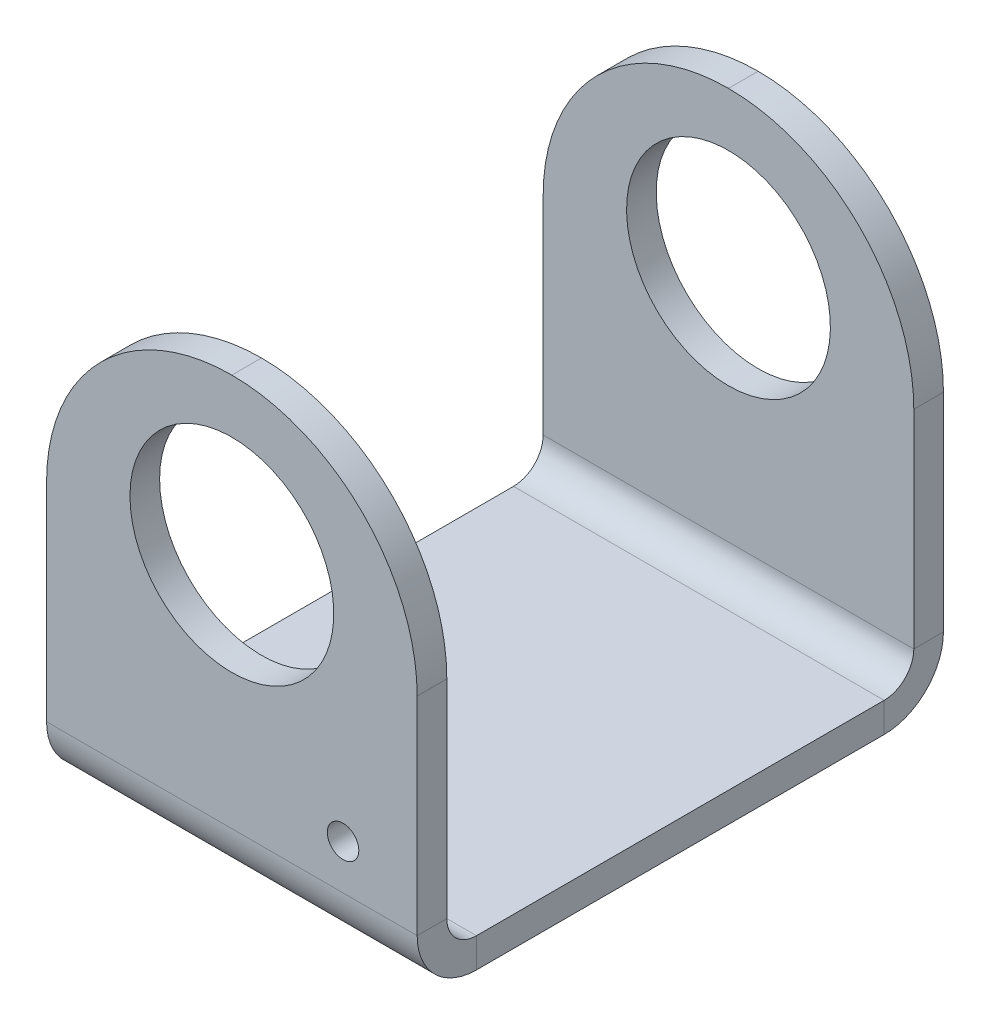
from build123d import *

# Parameters (mm, degrees)
SKETCH_10_W                   = 100
SKETCH_10_H                   = 110
SM_BASE_FLANGE_2_DEPTH        = 8
SM_EDGE_FLANGE_3_DEPTH        = 100
SM_START                      = 8
SM_EDGE_FLANGE_3_PROFILE_W    = 100
SM_EDGE_FLANGE_3_PROFILE_H    = 106
SM_EDGE_FLANGE_3_PROFILE_R    = 27.5
SM_EDGE_FLANGE_3_FLAT_DEPTH   = 8
SM_EDGE_FLANGE_3_BEND_DEPTH   = 100
SM_EDGE_FLANGE_3_PROFILE_2_W  = 100
SM_EDGE_FLANGE_3_PROFILE_2_H  = 106
SM_EDGE_FLANGE_3_PROFILE_2_R  = 27.5
SM_EDGE_FLANGE_3_FLAT_2_DEPTH = 8
HOLE_WIZARD_M10_1_D           = 8.5
HOLE_WIZARD_M10_1_DEPTH       = 27.5
HOLE_WIZARD_M10_1_TIP         = 2.553657631
FILLET_1_R                    = 50


# Sheet-metal steps are written as plain solids
with BuildPart() as part:
    # 草图10 → 基体-法兰2 (new body)
    with BuildSketch(Plane(origin=(0, 0, 0), x_dir=(1, 0, 0), z_dir=(0, 1, 0))):
        Rectangle(SKETCH_10_W, SKETCH_10_H)
    extrude(amount=-SM_BASE_FLANGE_2_DEPTH)

    # 边线-法兰3 bend section (across the edge) → 边线-法兰3 (add)
    with BuildSketch(Plane(origin=(-50, 0, 63), x_dir=(0, 0, -1), z_dir=(1, 0, 0))):
        with BuildLine():
            Line((-8, 8), (0, 8))
            ThreePointArc((0, 8), (2.343145751, 2.343145751), (8, 0))
            Line((8, 0), (8, -8))
            ThreePointArc((8, -8), (-3.313708499, -3.313708499), (-8, 8))
        make_face()
    extrude(amount=SM_EDGE_FLANGE_3_DEPTH)

    # 边线-法兰3 profile (on flange) → 边线-法兰3 flat (add)
    with BuildSketch(Plane.XY.offset(63).offset(SM_START)):
        with Locations((0, 61)):
            Rectangle(SM_EDGE_FLANGE_3_PROFILE_W, SM_EDGE_FLANGE_3_PROFILE_H)
        with Locations((0, 72)):
            Circle(SM_EDGE_FLANGE_3_PROFILE_R, mode=Mode.SUBTRACT)
    extrude(amount=-SM_EDGE_FLANGE_3_FLAT_DEPTH)

    # 边线-法兰3 bend section 2 (across the edge) → 边线-法兰3 bend (add)
    with BuildSketch(Plane(origin=(50, 0, -63), x_dir=(0, 0, 1), z_dir=(-1, 0, 0))):
        with BuildLine():
            Line((-8, 8), (0, 8))
            ThreePointArc((0, 8), (2.343145751, 2.343145751), (8, 0))
            Line((8, 0), (8, -8))
            ThreePointArc((8, -8), (-3.313708499, -3.313708499), (-8, 8))
        make_face()
    extrude(amount=SM_EDGE_FLANGE_3_BEND_DEPTH)

    # 边线-法兰3 profile 2 (on flange) → 边线-法兰3 flat 2 (add)
    with BuildSketch(Plane(origin=(0, 0, -63), x_dir=(-1, 0, 0), z_dir=(0, 0, -1)).offset(SM_START)):
        with Locations((0, 61)):
            Rectangle(SM_EDGE_FLANGE_3_PROFILE_2_W, SM_EDGE_FLANGE_3_PROFILE_2_H)
        with Locations((0, 72)):
            Circle(SM_EDGE_FLANGE_3_PROFILE_2_R, mode=Mode.SUBTRACT)
    extrude(amount=-SM_EDGE_FLANGE_3_FLAT_2_DEPTH)

    # M10 螺纹孔1
    with Locations(Plane.XY.offset(71)):
        with Locations((30, 20.038475773)):
            Hole(HOLE_WIZARD_M10_1_D / 2, depth=HOLE_WIZARD_M10_1_DEPTH)
            with Locations((0, 0, -(HOLE_WIZARD_M10_1_DEPTH + HOLE_WIZARD_M10_1_TIP / 2))):  # 118° drill point
                Cone(0, HOLE_WIZARD_M10_1_D / 2, HOLE_WIZARD_M10_1_TIP, mode=Mode.SUBTRACT)

    # 圆角1
    fillet_1_edges = [part.edges().sort_by_distance(p)[0] for p in [
        (50, 114, -67),
        (-50, 114, -67),
        (-50, 114, 67),
        (50, 114, 67),
    ]]
    fillet(fillet_1_edges, radius=FILLET_1_R - 0.0001)  # a hair under: the kernel refuses the full size


solid = part.part
